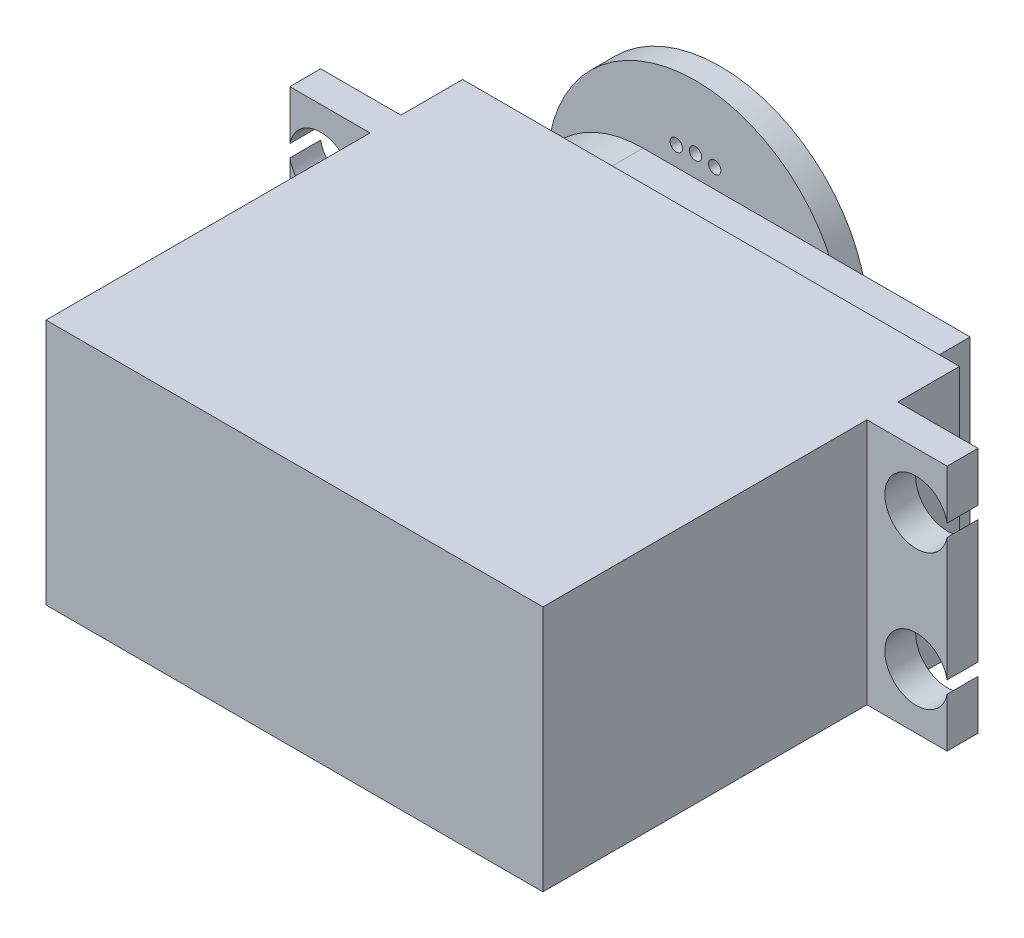
from build123d import *

# Parameters (mm, degrees)
BOSS_EXTRUDE1_DEPTH = 20
SKETCH3_W           = 36
SKETCH3_H           = 19
BOSS_EXTRUDE2_DEPTH = 3
FILLET3_R           = 9.5
FILLET4_R           = 9.5
SKETCH4_R           = 5
BOSS_EXTRUDE3_DEPTH = 4.24
SKETCH5_R           = 12
BOSS_EXTRUDE4_DEPTH = 2
SKETCH6_R           = 2.55
CUT_EXTRUDE4_DEPTH  = 46.01365694
SKETCH8_R           = 0.5
CUT_EXTRUDE5_DEPTH  = 2


with BuildPart() as part:
    # Sketch1 → Boss-Extrude1 (new body)
    with BuildSketch(Plane(origin=(0, 0, 0), x_dir=(1, 0, 0), z_dir=(0, 1, 0))):
        Polygon((20.135, 9.38), (26.635, 9.38), (26.635, 11.88), (20.135, 11.88), (20.135, 16.88), (-20.135, 16.88), (-20.135, 11.88), (-26.635, 11.88), (-26.635, 9.38), (-20.135, 9.38), (-20.135, -16.88), (20.135, -16.88), align=None)
    extrude(amount=BOSS_EXTRUDE1_DEPTH)

    # Sketch3 → Boss-Extrude2 (add)
    with BuildSketch(Plane(origin=(0, 0, -16.88), x_dir=(-1, 0, 0), z_dir=(0, 0, -1))):
        with Locations((0, 10)):
            Rectangle(SKETCH3_W, SKETCH3_H)
    extrude(amount=BOSS_EXTRUDE2_DEPTH)

    # Fillet3
    fillet3_edges = [part.edges().sort_by_distance(p)[0] for p in [
        (-18, 19.5, -18.38),
    ]]
    fillet(fillet3_edges, radius=FILLET3_R)

    # Fillet4
    fillet4_edges = [part.edges().sort_by_distance(p)[0] for p in [
        (-18, 0.5, -18.38),
    ]]
    fillet(fillet4_edges, radius=FILLET4_R - 0.0001)  # a hair under: the kernel refuses the full size

    # Sketch4 → Boss-Extrude3 (add)
    with BuildSketch(Plane(origin=(0, 0, -19.88), x_dir=(-1, 0, 0), z_dir=(0, 0, -1))):
        with Locations(Location((8.5, 10, 0), (0, 0, 180))):
            Circle(SKETCH4_R)
    extrude(amount=BOSS_EXTRUDE3_DEPTH)

    # Sketch5 → Boss-Extrude4 (add)
    with BuildSketch(Plane(origin=(0, 0, -24.12), x_dir=(-1, 0, 0), z_dir=(0, 0, -1))):
        with Locations((8.5, 10.128454218)):
            Circle(SKETCH5_R)
    extrude(amount=BOSS_EXTRUDE4_DEPTH)

    # Sketch6 → Cut-Extrude4 (cut, through all)
    with BuildSketch(Plane(origin=(0, 0, -11.88), x_dir=(-1, 0, 0), z_dir=(0, 0, -1))):
        with Locations((-24.135, 15.5)):
            Circle(SKETCH6_R)
        with Locations((-24.135, 4.5)):
            Circle(SKETCH6_R)
        with Locations((24.135, 15.5)):
            Circle(SKETCH6_R)
        with Locations((24.135, 4.5)):
            Circle(SKETCH6_R)
    extrude(amount=-CUT_EXTRUDE4_DEPTH, mode=Mode.SUBTRACT)

    # Sketch8 → Cut-Extrude5 (cut)
    with BuildSketch(Plane(origin=(0, 0, -26.12), x_dir=(-1, 0, 0), z_dir=(0, 0, -1))):
        with Locations((8.5, 10)):
            Circle(SKETCH8_R)
        with Locations((1.675504615, 11.557646538)):
            Circle(SKETCH8_R)
        with Locations((1.5, 10)):
            Circle(SKETCH8_R)
        with Locations((6.942353462, 16.824495385)):
            Circle(SKETCH8_R)
        with Locations((8.5, 17)):
            Circle(SKETCH8_R)
        with Locations((10.057646538, 16.824495385)):
            Circle(SKETCH8_R)
        with Locations((15.324495385, 11.557646538)):
            Circle(SKETCH8_R)
        with Locations((15.5, 10)):
            Circle(SKETCH8_R)
        with Locations((15.324495385, 8.442353462)):
            Circle(SKETCH8_R)
        with Locations((10.057646538, 3.175504615)):
            Circle(SKETCH8_R)
        with Locations((8.5, 3)):
            Circle(SKETCH8_R)
        with Locations((6.942353462, 3.175504615)):
            Circle(SKETCH8_R)
        with Locations((1.675504615, 8.442353462)):
            Circle(SKETCH8_R)
    extrude(amount=-CUT_EXTRUDE5_DEPTH, mode=Mode.SUBTRACT)


solid = part.part
